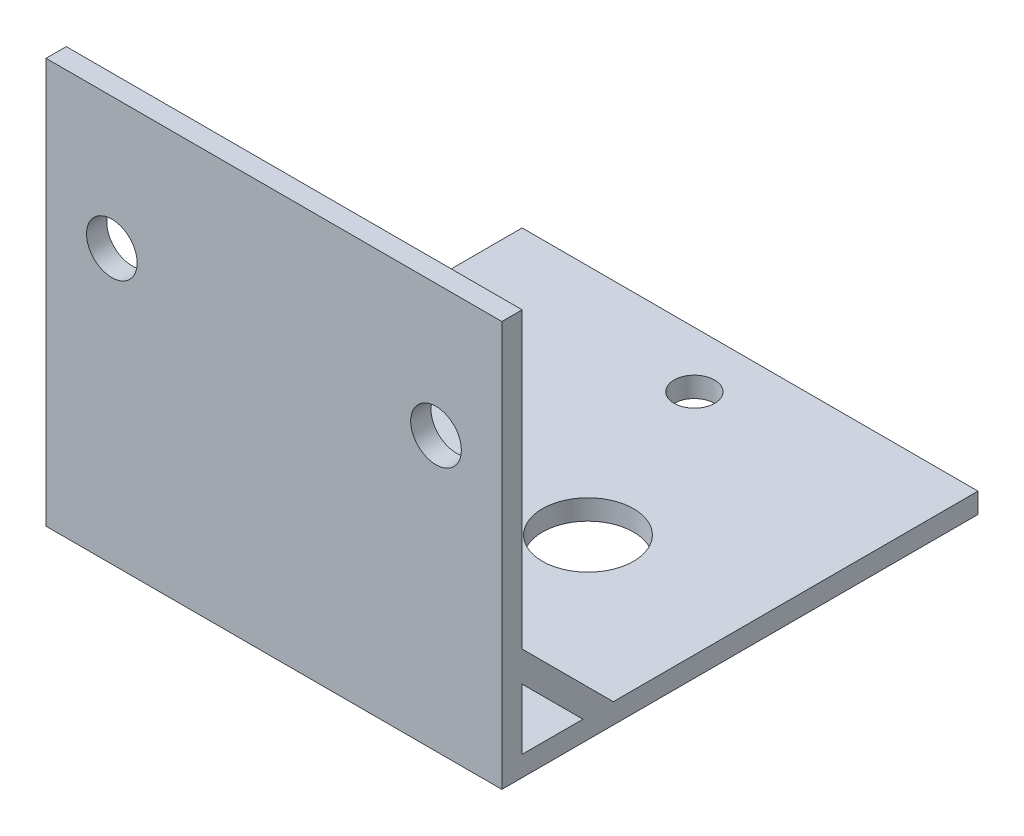
from build123d import *

# Parameters (mm, degrees)
SKETCH7_W           = 45
SKETCH7_H           = 45
SKETCH7_R           = 2
SKETCH7_R_2         = 4.5
BOSS_EXTRUDE5_DEPTH = 2
SKETCH7_3_W         = 45
SKETCH7_3_H         = 2
BOSS_EXTRUDE6_DEPTH = 40
BOSS_EXTRUDE7_DEPTH = 2
SKETCH10_R          = 2.5
CUT_EXTRUDE2_DEPTH  = 2


with BuildPart() as part:
    # Sketch7 → Boss-Extrude5 (new body)
    with BuildSketch(Plane(origin=(0, 0, 0), x_dir=(1, 0, 0), z_dir=(0, 1, 0))):
        with Locations((5.756289545, -118.050969126)):
            Rectangle(SKETCH7_W, SKETCH7_H)
        with Locations((5.756289545, -136.050969126)):
            Circle(SKETCH7_R, mode=Mode.SUBTRACT)
        with Locations((5.756289545, -101.050969126)):
            Circle(SKETCH7_R, mode=Mode.SUBTRACT)
        with Locations((12.756289545, -118.550969126)):
            Circle(SKETCH7_R_2, mode=Mode.SUBTRACT)
    extrude(amount=BOSS_EXTRUDE5_DEPTH)

    # Sketch7<3> → Boss-Extrude6 (add)
    with BuildSketch(Plane(origin=(0, 0, 0), x_dir=(1, 0, 0), z_dir=(0, 1, 0))):
        with Locations((5.756289545, -141.550969126)):
            Rectangle(SKETCH7_3_W, SKETCH7_3_H)
    extrude(amount=BOSS_EXTRUDE6_DEPTH)

    # Sketch8 → Boss-Extrude7 (add)
    with BuildSketch(Plane.ZY.offset(16.743710455)):
        Polygon((140.550969126, 8), (134.550969126, 2), (131.550969126, 2), (140.550969126, 11), align=None)
    boss_extrude7 = extrude(amount=-BOSS_EXTRUDE7_DEPTH)

    # Mirror2: Boss-Extrude7 across plane
    add(boss_extrude7.mirror(Plane.ZY.offset(-5.756289545)))

    # Sketch10 → Cut-Extrude2 (cut)
    with BuildSketch(Plane.XY.offset(142.550969126)):
        with Locations((21.756289545, 27)):
            Circle(SKETCH10_R)
        with Locations((-10.243710455, 27)):
            Circle(SKETCH10_R)
    extrude(amount=-CUT_EXTRUDE2_DEPTH, mode=Mode.SUBTRACT)


solid = part.part
